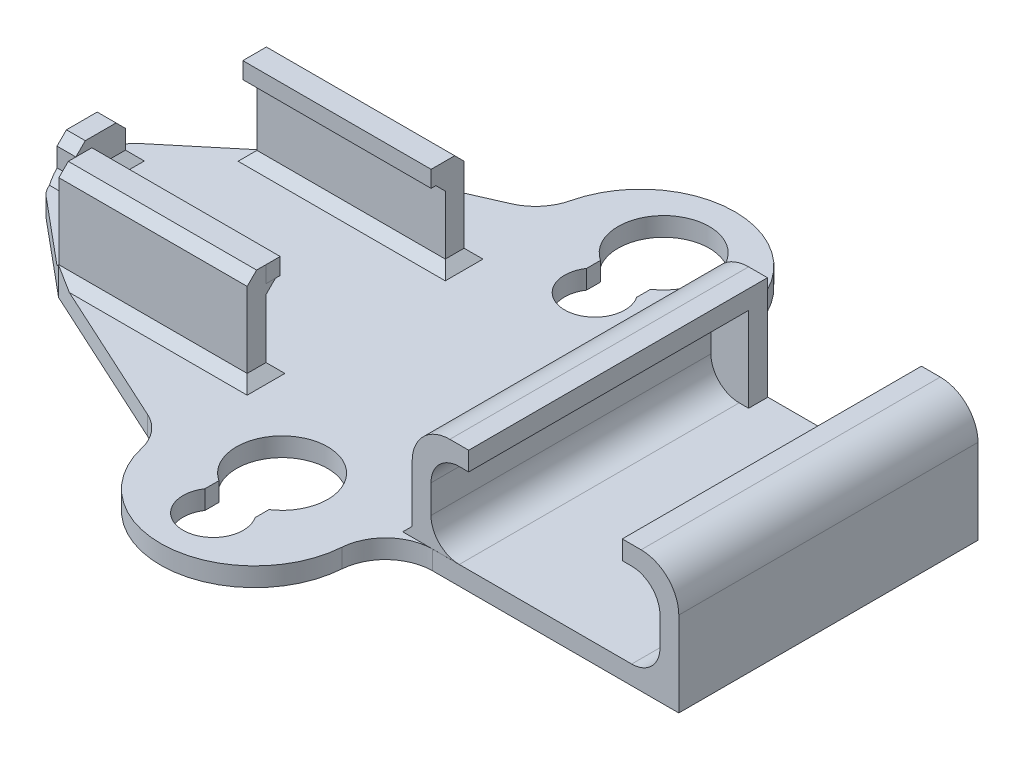
from build123d import *

# Parameters (mm, degrees)
BOSS_EXTRUDE3_DEPTH  = 2
SKETCH2_W            = 19.982686102
SKETCH2_H            = 2
SKETCH2_W_2          = 19.980275276
BOSS_EXTRUDE4_DEPTH  = 10
SKETCH4_W            = 19.982686102
SKETCH4_H            = 1.75
BOSS_EXTRUDE6_DEPTH  = 1.5
SKETCH5_W            = 19.982686102
SKETCH5_H            = 1.75
BOSS_EXTRUDE7_DEPTH  = 1.5
SKETCH6_W            = 2
SKETCH6_H            = 31.703693322
SKETCH6_H_2          = 31.749526842
BOSS_EXTRUDE8_DEPTH  = 11
SKETCH7_W            = 31.749526842
SKETCH7_H            = 2
BOSS_EXTRUDE9_DEPTH  = 4
SKETCH8_W            = 31.703693322
SKETCH8_H            = 2
BOSS_EXTRUDE10_DEPTH = 4
SKETCH9_W            = 2
SKETCH9_H            = 9
BOSS_EXTRUDE11_DEPTH = 4
SKETCH11_W           = 2
SKETCH11_H           = 9
BOSS_EXTRUDE12_DEPTH = 4
FILLET3_R            = 3
FILLET4_R            = 4
FILLET5_R            = 4
CHAMFER3_SIZE        = 1
SKETCH13_W           = 2
SKETCH13_H           = 5.263388165
BOSS_EXTRUDE13_DEPTH = 4
CHAMFER4_SIZE        = 1
CHAMFER5_SIZE        = 1


with BuildPart() as part:
    # Sketch1 → Boss-Extrude3 (new body)
    with BuildSketch(Plane(origin=(0, 0, 0), x_dir=(1, 0, 0), z_dir=(0, 1, 0))):
        with BuildLine():
            Line((-8.328383402, 17.178082192), (-11.926539406, 14.179618856))
            Line((-11.926539406, 14.179618856), (-16.248936601, 10.577621193))
            ThreePointArc((-16.248936601, 10.577621193), (-17.045151666, 9.545423543), (-17.328383402, 8.272957354))
            Line((-17.328383402, 8.272957354), (-17.328383402, 3.08320703))
            ThreePointArc((-17.328383402, 3.08320703), (-17.045151666, 1.810740841), (-16.248936601, 0.778543191))
            Line((-16.248936601, 0.778543191), (-11.926539406, -2.823454472))
            Line((-11.926539406, -2.823454472), (-8.328383402, -5.821917808))
            Line((-8.328383402, -5.821917808), (9.145578492, -13.850782578))
            ThreePointArc((9.145578492, -13.850782578), (10.93396709, -15.23549913), (11.929216114, -17.266571036))
            ThreePointArc((11.929216114, -17.266571036), (22.445955603, -24.981411148), (31.645385182, -15.735273423))
            ThreePointArc((31.645385182, -15.735273423), (33.227096416, -12.435935871), (36.632269474, -11.097192))
            Line((36.632269474, -11.097192), (62.759585841, -11.097192))
            Line((62.759585841, -11.097192), (62.759585841, 20.652334842))
            Line((62.759585841, 20.652334842), (36.659964719, 20.652334842))
            ThreePointArc((36.659964719, 20.652334842), (33.089388299, 22.15219427), (31.660956961, 25.751941231))
            ThreePointArc((31.660956961, 25.751941231), (22.916780781, 35.872236959), (11.929724224, 28.245600027))
            ThreePointArc((11.929724224, 28.245600027), (10.905359885, 26.19326698), (9.072373225, 24.814298837))
            Line((9.072373225, 24.814298837), (-8.328383402, 17.178082192))
        make_face()
        with BuildLine():
            Line((24.320629097, -16.144178085), (24.320629097, -17.62452967))
            ThreePointArc((24.320629097, -17.62452967), (21.662941444, -22.60685858), (19.005253792, -17.62452967))
            Line((19.005253792, -17.62452967), (19.005253792, -16.144178085))
            ThreePointArc((19.005253792, -16.144178085), (21.662941444, -7.256310151), (24.320629097, -16.144178085))
        make_face(mode=Mode.SUBTRACT)
        with BuildLine():
            Line((24.320629097, 24.348091169), (24.320629097, 22.867739584))
            ThreePointArc((24.320629097, 22.867739584), (21.662941444, 17.885410674), (19.005253792, 22.867739584))
            Line((19.005253792, 22.867739584), (19.005253792, 24.348091169))
            ThreePointArc((19.005253792, 24.348091169), (21.662941444, 33.235959102), (24.320629097, 24.348091169))
        make_face(mode=Mode.SUBTRACT)
    extrude(amount=BOSS_EXTRUDE3_DEPTH)

    # Sketch2 → Boss-Extrude4 (add)
    with BuildSketch(Plane(origin=(0, 2, 0), x_dir=(1, 0, 0), z_dir=(0, 1, 0))):
        with Locations((1.662959649, 16.226428568)):
            Rectangle(SKETCH2_W, SKETCH2_H)
        with Locations((1.661754236, -4.792288058)):
            Rectangle(SKETCH2_W_2, SKETCH2_H)
    extrude(amount=BOSS_EXTRUDE4_DEPTH)

    # Sketch4 → Boss-Extrude6 (add)
    with BuildSketch(Plane.XY.offset(-15.226428568)):
        with Locations((1.662959649, 11.125)):
            Rectangle(SKETCH4_W, SKETCH4_H)
    extrude(amount=BOSS_EXTRUDE6_DEPTH)

    # Sketch5 → Boss-Extrude7 (add)
    with BuildSketch(Plane(origin=(0, 0, 3.792288058), x_dir=(-1, 0, 0), z_dir=(0, 0, -1))):
        with Locations((-1.662959649, 11.125)):
            Rectangle(SKETCH5_W, SKETCH5_H)
    extrude(amount=BOSS_EXTRUDE7_DEPTH)

    # Sketch6 → Boss-Extrude8 (add)
    with BuildSketch(Plane(origin=(0, 2, 0), x_dir=(1, 0, 0), z_dir=(0, 1, 0))):
        with Locations((35.459585841, 4.759099079)):
            Rectangle(SKETCH6_W, SKETCH6_H)
        with Locations((61.759585841, 4.777571421)):
            Rectangle(SKETCH6_W, SKETCH6_H_2)
    extrude(amount=BOSS_EXTRUDE8_DEPTH)

    # Sketch7 → Boss-Extrude9 (add)
    with BuildSketch(Plane.ZY.offset(-60.759585841)):
        with Locations((-4.777571421, 12)):
            Rectangle(SKETCH7_W, SKETCH7_H)
    extrude(amount=BOSS_EXTRUDE9_DEPTH)

    # Sketch8 → Boss-Extrude10 (add)
    with BuildSketch(Plane(origin=(36.459585841, 0, 0), x_dir=(0, 0, -1), z_dir=(1, 0, 0))):
        with Locations((4.759099079, 12)):
            Rectangle(SKETCH8_W, SKETCH8_H)
    extrude(amount=BOSS_EXTRUDE10_DEPTH)

    # Sketch9 → Boss-Extrude11 (add)
    with BuildSketch(Plane(origin=(36.459585841, 0, 0), x_dir=(0, 0, -1), z_dir=(1, 0, 0))):
        with Locations((19.61094574, 6.5)):
            Rectangle(SKETCH9_W, SKETCH9_H)
    extrude(amount=BOSS_EXTRUDE11_DEPTH)

    # Sketch11 → Boss-Extrude12 (add)
    with BuildSketch(Plane.ZY.offset(-60.759585841)):
        with Locations((-19.652334842, 6.5)):
            Rectangle(SKETCH11_W, SKETCH11_H)
    extrude(amount=BOSS_EXTRUDE12_DEPTH)

    # Fillet3
    fillet3_edges = [part.edges().sort_by_distance(p)[0] for p in [
        (36.459585841, 2, -3.759099079),
        (36.459585841, 11, -3.759099079),
        (60.759585841, 11, -3.777571421),
        (60.759585841, 2, -3.777571421),
    ]]
    fillet(fillet3_edges, radius=FILLET3_R)

    # Fillet4
    fillet4_edges = [part.edges().sort_by_distance(p)[0] for p in [
        (62.759585841, 13, -4.777571421),
    ]]
    fillet(fillet4_edges, radius=FILLET4_R)

    # Fillet5
    fillet5_edges = [part.edges().sort_by_distance(p)[0] for p in [
        (34.459585841, 13, -4.759099079),
    ]]
    fillet(fillet5_edges, radius=FILLET5_R)

    # Chamfer3
    # the kernel refuses this chamfer: 1 mm, written as the material it adds along each edge
    with BuildSketch(Plane(origin=(34.459585841, 2, -20.61094574), x_dir=(0, 1, 0), z_dir=(0, 0, 1))) as chamfer3_piece_1:
        Polygon((CHAMFER3_SIZE, 0), (0, CHAMFER3_SIZE), (0, 0), align=None)
    extrude(amount=31.703693323)
    with BuildSketch(Plane(origin=(11.6543027, 2, -17.226428568), x_dir=(0, 0, -1), z_dir=(-1, 0, 0))) as chamfer3_piece_2_section:
        Polygon((CHAMFER3_SIZE, 0), (0, -CHAMFER3_SIZE), (0, 0), align=None)
    chamfer3_piece_2 = extrude(amount=22.444201507, mode=Mode.PRIVATE)
    chamfer3_piece_2 = split(chamfer3_piece_2, bisect_by=Plane(origin=(8.445196081, 2, -24.539065946), z_dir=(0.40185152236711835, 0, 0.9157048399846042)), keep=Keep.TOP, mode=Mode.PRIVATE)
    add(chamfer3_piece_2)
    with BuildSketch(Plane(origin=(11.651891874, 2, 5.792288058), x_dir=(0, 0, 1), z_dir=(-1, 0, 0))) as chamfer3_piece_3_section:
        Polygon((CHAMFER3_SIZE, 0), (0, CHAMFER3_SIZE), (0, 0), align=None)
    chamfer3_piece_3 = extrude(amount=19.980275276, mode=Mode.PRIVATE)
    chamfer3_piece_3 = split(chamfer3_piece_3, bisect_by=Plane(origin=(8.15775509, 2, 13.396901508), z_dir=(0.4175125238289849, 0, -0.9086711684905334)), keep=Keep.TOP, mode=Mode.PRIVATE)
    add(chamfer3_piece_3)

    # Sketch13 → Boss-Extrude13 (add)
    with BuildSketch(Plane(origin=(0, 2, 0), x_dir=(1, 0, 0), z_dir=(0, 1, 0))):
        with Locations((-16.328383402, 5.641263272)):
            Rectangle(SKETCH13_W, SKETCH13_H)
    extrude(amount=BOSS_EXTRUDE13_DEPTH)

    # Chamfer4
    # the kernel refuses this chamfer: 1 mm, written as the material it adds along each edge
    with BuildSketch(Plane(origin=(11.6543027, 10.25, -15.226428568), x_dir=(0, -1, 0), z_dir=(-1, 0, 0))) as chamfer4_piece_1:
        Polygon((CHAMFER4_SIZE, 0), (0, CHAMFER4_SIZE), (0, 0), align=None)
    extrude(amount=19.982686102)
    with BuildSketch(Plane(origin=(11.651891874, 10.25, 3.792288058), x_dir=(0, -1, 0), z_dir=(-1, 0, 0))) as chamfer4_piece_2:
        Polygon((CHAMFER4_SIZE, 0), (0, -CHAMFER4_SIZE), (0, 0), align=None)
    extrude(amount=19.980275276)
    with BuildSketch(Plane(origin=(-19.90006639, 2, -8.272957354), x_dir=(0, 0, -1), z_dir=(1, 0, 0))) as chamfer4_piece_3_section:
        Polygon((CHAMFER4_SIZE, 0), (0, CHAMFER4_SIZE), (0, 0), align=None)
    chamfer4_piece_3 = extrude(amount=4.571682988, mode=Mode.PRIVATE)
    chamfer4_piece_3 = chamfer4_piece_3 & Plane(origin=(-14.328383402, 2, -8.272957354), x_dir=(-0.6401843996644775, 0, -0.7682212795973778), z_dir=(0, -1, 0)) * Cylinder(3, 14, mode=Mode.PRIVATE)
    add(chamfer4_piece_3)
    with BuildSketch(Plane(origin=(-15.328383402, 2, -3.009569189), x_dir=(0, 0, 1), z_dir=(-1, 0, 0))) as chamfer4_piece_4_section:
        Polygon((CHAMFER4_SIZE, 0), (0, CHAMFER4_SIZE), (0, 0), align=None)
    chamfer4_piece_4 = extrude(amount=4.570779097, mode=Mode.PRIVATE)
    chamfer4_piece_4 = chamfer4_piece_4 & Plane(origin=(-14.328383402, 2, -3.08320703), x_dir=(-1, 0, 0), z_dir=(0, -1, 0)) * Cylinder(3, 14, mode=Mode.PRIVATE)
    add(chamfer4_piece_4)
    with BuildSketch(Plane(origin=(-15.328383402, 2, -8.272957354), x_dir=(1, 0, 0), z_dir=(0, 0, 1))) as chamfer4_piece_5:
        Polygon((CHAMFER4_SIZE, 0), (0, CHAMFER4_SIZE), (0, 0), align=None)
    extrude(amount=5.263388164)
    with BuildSketch(Plane(origin=(11.651891874, 2, 9.363971046), x_dir=(0, 1, 0), z_dir=(0, 0, -1))) as chamfer4_piece_6_section:
        Polygon((CHAMFER4_SIZE, 0), (0, CHAMFER4_SIZE), (0, 0), align=None)
    chamfer4_piece_6 = extrude(amount=5.571682988, mode=Mode.PRIVATE)
    chamfer4_piece_6 = split(chamfer4_piece_6, bisect_by=Plane(origin=(11.651891874, 0.714158506, 8.078129552), z_dir=(0, -0.7071067811865476, -0.7071067811865476)), keep=Keep.TOP, mode=Mode.PRIVATE)
    add(chamfer4_piece_6)
    with BuildSketch(Plane(origin=(-8.328383402, 2, 3.792288058), x_dir=(0, 1, 0), z_dir=(0, 0, 1))) as chamfer4_piece_7_section:
        Polygon((CHAMFER4_SIZE, 0), (0, CHAMFER4_SIZE), (0, 0), align=None)
    chamfer4_piece_7 = extrude(amount=4.601312738, mode=Mode.PRIVATE)
    chamfer4_piece_7 = split(chamfer4_piece_7, bisect_by=Plane(origin=(-8.328383402, 3.5, 5.292288058), z_dir=(0, -0.7071067811865476, -0.7071067811865476)), keep=Keep.TOP, mode=Mode.PRIVATE)
    chamfer4_piece_7 = split(chamfer4_piece_7, bisect_by=Plane(origin=(-9.326561968, 2, 4.990102337), z_dir=(0.6401843996644799, 0, -0.7682212795973757)), keep=Keep.TOP, mode=Mode.PRIVATE)
    add(chamfer4_piece_7)
    with BuildSketch(Plane(origin=(-8.328383402, 2, 3.792288058), x_dir=(0, 0, -1), z_dir=(1, 0, 0))) as chamfer4_piece_8:
        Polygon((CHAMFER4_SIZE, 0), (0, CHAMFER4_SIZE), (0, 0), align=None)
    extrude(amount=19.980275276)
    with BuildSketch(Plane(origin=(11.6543027, 2, -15.226428568), x_dir=(1, 0, 0), z_dir=(0, 0, -1))) as chamfer4_piece_9_section:
        Polygon((CHAMFER4_SIZE, 0), (0, -CHAMFER4_SIZE), (0, 0), align=None)
    chamfer4_piece_9 = extrude(amount=5.571682988, mode=Mode.PRIVATE)
    chamfer4_piece_9 = split(chamfer4_piece_9, bisect_by=Plane(origin=(11.6543027, 3.5, -16.726428568), z_dir=(0, -0.7071067811865476, 0.7071067811865476)), keep=Keep.TOP, mode=Mode.PRIVATE)
    add(chamfer4_piece_9)
    with BuildSketch(Plane(origin=(-8.328383402, 2, -19.74976518), x_dir=(-1, 0, 0), z_dir=(0, 0, 1))) as chamfer4_piece_10_section:
        Polygon((CHAMFER4_SIZE, 0), (0, -CHAMFER4_SIZE), (0, 0), align=None)
    chamfer4_piece_10 = extrude(amount=4.523336611, mode=Mode.PRIVATE)
    chamfer4_piece_10 = split(chamfer4_piece_10, bisect_by=Plane(origin=(-7.063621277, 2, -18.232050629), z_dir=(0.6401843996644802, 0, 0.7682212795973757)), keep=Keep.TOP, mode=Mode.PRIVATE)
    add(chamfer4_piece_10)
    with BuildSketch(Plane(origin=(-8.328383402, 2, -15.226428568), x_dir=(0, 0, 1), z_dir=(1, 0, 0))) as chamfer4_piece_11:
        Polygon((CHAMFER4_SIZE, 0), (0, -CHAMFER4_SIZE), (0, 0), align=None)
    extrude(amount=19.982686102)
    with BuildSketch(Plane(origin=(-15.328383402, 2, -10.844640342), x_dir=(1, 0, 0), z_dir=(0, 0, 1))) as chamfer4_piece_12a_section:
        Polygon((CHAMFER4_SIZE, 0), (0, CHAMFER4_SIZE), (0, 0), align=None)
    chamfer4_piece_12a = extrude(amount=7.835071152, mode=Mode.PRIVATE)
    chamfer4_piece_12a = split(chamfer4_piece_12a, bisect_by=Plane(origin=(-15.328383402, 2, -8.272957354), z_dir=(0, 0, -1)), keep=Keep.TOP, mode=Mode.PRIVATE)
    with BuildSketch(Plane(origin=(-17.328383402, 2, -8.272957354), x_dir=(0, 0, -1), z_dir=(1, 0, 0))) as chamfer4_piece_12b_section:
        Polygon((CHAMFER4_SIZE, 0), (0, CHAMFER4_SIZE), (0, 0), align=None)
    chamfer4_piece_12b = extrude(amount=4.571682988, mode=Mode.PRIVATE)
    chamfer4_piece_12b = split(chamfer4_piece_12b, bisect_by=Plane(origin=(-15.328383402, 2, -8.272957354), z_dir=(1, 0, 0)), keep=Keep.TOP, mode=Mode.PRIVATE)
    chamfer4_piece_12 = chamfer4_piece_12a & chamfer4_piece_12b
    add(chamfer4_piece_12)
    with BuildSketch(Plane(origin=(-12.756700414, 2, -3.009569189), x_dir=(0, 0, 1), z_dir=(-1, 0, 0))) as chamfer4_piece_13a_section:
        Polygon((CHAMFER4_SIZE, 0), (0, CHAMFER4_SIZE), (0, 0), align=None)
    chamfer4_piece_13a = extrude(amount=7.142462085, mode=Mode.PRIVATE)
    chamfer4_piece_13a = split(chamfer4_piece_13a, bisect_by=Plane(origin=(-15.328383402, 2, -3.009569189), z_dir=(1, 0, 0)), keep=Keep.TOP, mode=Mode.PRIVATE)
    with BuildSketch(Plane(origin=(-15.328383402, 2, -8.272957354), x_dir=(1, 0, 0), z_dir=(0, 0, 1))) as chamfer4_piece_13b_section:
        Polygon((CHAMFER4_SIZE, 0), (0, CHAMFER4_SIZE), (0, 0), align=None)
    chamfer4_piece_13b = extrude(amount=7.835071152, mode=Mode.PRIVATE)
    chamfer4_piece_13b = split(chamfer4_piece_13b, bisect_by=Plane(origin=(-15.328383402, 2, -3.009569189), z_dir=(0, 0, 1)), keep=Keep.TOP, mode=Mode.PRIVATE)
    chamfer4_piece_13 = chamfer4_piece_13a & chamfer4_piece_13b
    add(chamfer4_piece_13)
    with BuildSketch(Plane(origin=(11.651891874, 2, 9.363971046), x_dir=(0, 1, 0), z_dir=(0, 0, -1))) as chamfer4_piece_14a_section:
        Polygon((CHAMFER4_SIZE, 0), (0, CHAMFER4_SIZE), (0, 0), align=None)
    chamfer4_piece_14a = extrude(amount=8.143365976, mode=Mode.PRIVATE)
    chamfer4_piece_14a = split(chamfer4_piece_14a, bisect_by=Plane(origin=(11.651891874, 2, 3.792288058), z_dir=(0, 0, -1)), keep=Keep.TOP, mode=Mode.PRIVATE)
    with BuildSketch(Plane(origin=(-8.328383402, 2, 3.792288058), x_dir=(0, 0, -1), z_dir=(1, 0, 0))) as chamfer4_piece_14b_section:
        Polygon((CHAMFER4_SIZE, 0), (0, CHAMFER4_SIZE), (0, 0), align=None)
    chamfer4_piece_14b = extrude(amount=22.551958264, mode=Mode.PRIVATE)
    chamfer4_piece_14b = split(chamfer4_piece_14b, bisect_by=Plane(origin=(11.651891874, 2, 3.792288058), z_dir=(1, 0, 0)), keep=Keep.TOP, mode=Mode.PRIVATE)
    chamfer4_piece_14 = chamfer4_piece_14a & chamfer4_piece_14b
    add(chamfer4_piece_14)
    with BuildSketch(Plane(origin=(-8.328383402, 2, 1.22060507), x_dir=(0, 1, 0), z_dir=(0, 0, 1))) as chamfer4_piece_15a_section:
        Polygon((CHAMFER4_SIZE, 0), (0, CHAMFER4_SIZE), (0, 0), align=None)
    chamfer4_piece_15a = extrude(amount=7.172995726, mode=Mode.PRIVATE)
    chamfer4_piece_15a = split(chamfer4_piece_15a, bisect_by=Plane(origin=(-8.328383402, 2, 3.792288058), z_dir=(0, 0, -1)), keep=Keep.TOP, mode=Mode.PRIVATE)
    with BuildSketch(Plane(origin=(-10.90006639, 2, 3.792288058), x_dir=(0, 0, -1), z_dir=(1, 0, 0))) as chamfer4_piece_15b_section:
        Polygon((CHAMFER4_SIZE, 0), (0, CHAMFER4_SIZE), (0, 0), align=None)
    chamfer4_piece_15b = extrude(amount=22.551958264, mode=Mode.PRIVATE)
    chamfer4_piece_15b = split(chamfer4_piece_15b, bisect_by=Plane(origin=(-8.328383402, 2, 3.792288058), z_dir=(-1, 0, 0)), keep=Keep.TOP, mode=Mode.PRIVATE)
    chamfer4_piece_15b = split(chamfer4_piece_15b, bisect_by=Plane(origin=(-10.844276518, 2, 3.725340212), z_dir=(0.6401843996644799, 0, -0.7682212795973757)), keep=Keep.TOP, mode=Mode.PRIVATE)
    chamfer4_piece_15 = chamfer4_piece_15a & chamfer4_piece_15b
    add(chamfer4_piece_15)
    with BuildSketch(Plane(origin=(-8.328383402, 2, -15.226428568), x_dir=(0, 0, 1), z_dir=(1, 0, 0))) as chamfer4_piece_16a_section:
        Polygon((CHAMFER4_SIZE, 0), (0, -CHAMFER4_SIZE), (0, 0), align=None)
    chamfer4_piece_16a = extrude(amount=22.55436909, mode=Mode.PRIVATE)
    chamfer4_piece_16a = split(chamfer4_piece_16a, bisect_by=Plane(origin=(11.6543027, 2, -15.226428568), z_dir=(1, 0, 0)), keep=Keep.TOP, mode=Mode.PRIVATE)
    with BuildSketch(Plane(origin=(11.6543027, 2, -12.65474558), x_dir=(1, 0, 0), z_dir=(0, 0, -1))) as chamfer4_piece_16b_section:
        Polygon((CHAMFER4_SIZE, 0), (0, -CHAMFER4_SIZE), (0, 0), align=None)
    chamfer4_piece_16b = extrude(amount=8.143365976, mode=Mode.PRIVATE)
    chamfer4_piece_16b = split(chamfer4_piece_16b, bisect_by=Plane(origin=(11.6543027, 2, -15.226428568), z_dir=(0, 0, 1)), keep=Keep.TOP, mode=Mode.PRIVATE)
    chamfer4_piece_16 = chamfer4_piece_16a & chamfer4_piece_16b
    add(chamfer4_piece_16)
    with BuildSketch(Plane(origin=(-8.328383402, 2, -19.74976518), x_dir=(-1, 0, 0), z_dir=(0, 0, 1))) as chamfer4_piece_17a_section:
        Polygon((CHAMFER4_SIZE, 0), (0, -CHAMFER4_SIZE), (0, 0), align=None)
    chamfer4_piece_17a = extrude(amount=7.095019599, mode=Mode.PRIVATE)
    chamfer4_piece_17a = split(chamfer4_piece_17a, bisect_by=Plane(origin=(-8.328383402, 2, -15.226428568), z_dir=(0, 0, 1)), keep=Keep.TOP, mode=Mode.PRIVATE)
    with BuildSketch(Plane(origin=(-10.90006639, 2, -15.226428568), x_dir=(0, 0, 1), z_dir=(1, 0, 0))) as chamfer4_piece_17b_section:
        Polygon((CHAMFER4_SIZE, 0), (0, -CHAMFER4_SIZE), (0, 0), align=None)
    chamfer4_piece_17b = extrude(amount=22.55436909, mode=Mode.PRIVATE)
    chamfer4_piece_17b = split(chamfer4_piece_17b, bisect_by=Plane(origin=(-10.805927603, 2, -15.113462024), z_dir=(0.6401843996644802, 0, 0.7682212795973757)), keep=Keep.TOP, mode=Mode.PRIVATE)
    chamfer4_piece_17b = split(chamfer4_piece_17b, bisect_by=Plane(origin=(-8.328383402, 2, -15.226428568), z_dir=(-1, 0, 0)), keep=Keep.TOP, mode=Mode.PRIVATE)
    chamfer4_piece_17 = chamfer4_piece_17a & chamfer4_piece_17b
    add(chamfer4_piece_17)
    # the kernel refuses this chamfer: 1 mm, written as the material it takes off along each edge
    with BuildSketch(Plane(origin=(14.223574861, 12, 5.792288058), x_dir=(0, 0, -1), z_dir=(-1, 0, 0))) as chamfer4_2_piece_1:
        Polygon((CHAMFER4_SIZE, 0), (0, CHAMFER4_SIZE), (0, 0), align=None)
    extrude(amount=25.123641252, mode=Mode.SUBTRACT)
    with BuildSketch(Plane(origin=(14.225985688, 12, -17.226428568), x_dir=(0, 0, 1), z_dir=(-1, 0, 0))) as chamfer4_2_piece_2:
        Polygon((CHAMFER4_SIZE, 0), (0, -CHAMFER4_SIZE), (0, 0), align=None)
    extrude(amount=25.126052078, mode=Mode.SUBTRACT)

    # Chamfer5
    chamfer5_edges = [part.edges().sort_by_distance(p)[0] for p in [
        (-16.328383402, 6, -3.009569189),
        (-16.328383402, 6, -8.272957354),
    ]]
    chamfer(chamfer5_edges, length=CHAMFER5_SIZE)


solid = part.part
